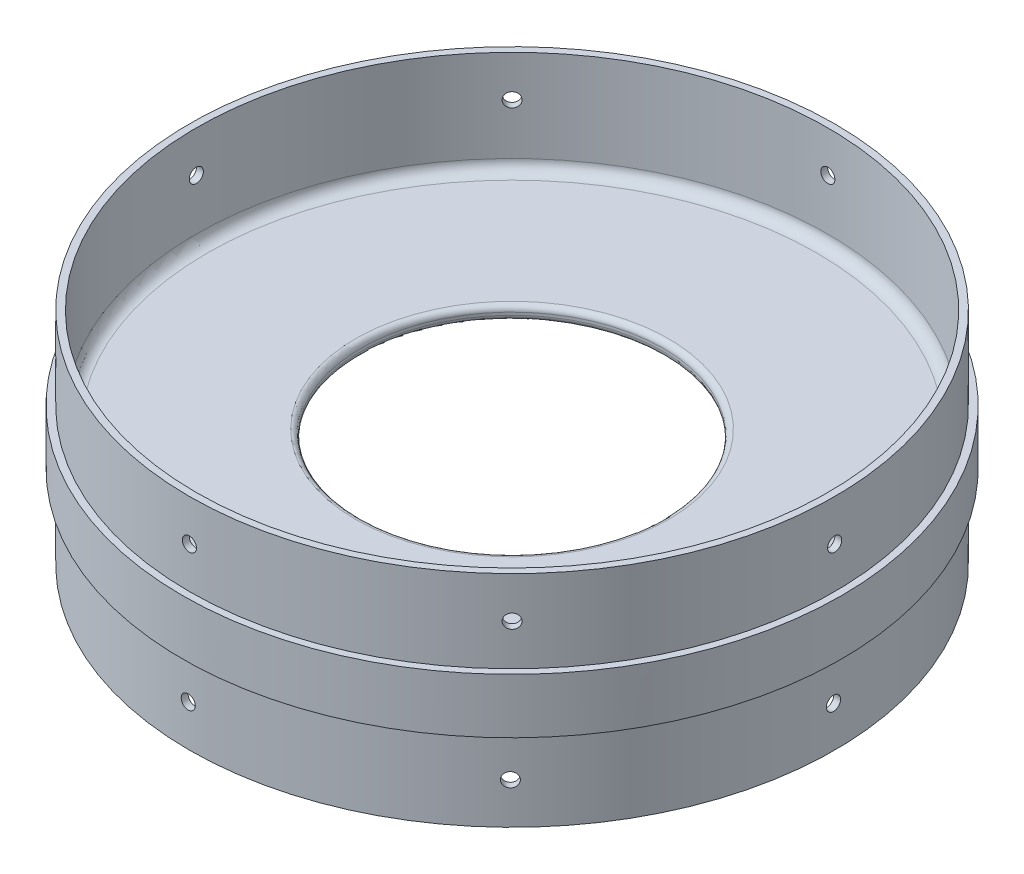
from build123d import *

# Parameters (mm, degrees)
SKETCH3_R                          = 152.4
BOSS_EXTRUDE1_DEPTH                = 101.6
CUT_EXTRUDE1_START                 = -38.1
SKETCH5_R                          = 152.4
SKETCH5_R_2                        = 149.225
CUT_EXTRUDE1_DEPTH                 = 38.1
SKETCH9_R                          = 146.05
CUT_EXTRUDE2_DEPTH                 = 47.625
SKETCH10_R                         = 69.85
CUT_EXTRUDE3_DEPTH                 = 223.181953869
SKETCH13_R                         = 152.4
SKETCH13_R_2                       = 149.225
CUT_EXTRUDE5_DEPTH                 = 38.1
CUT_EXTRUDE6_START                 = -47.625
SKETCH14_R                         = 146.05
CUT_EXTRUDE6_DEPTH                 = 47.625
FILLET3_R                          = 5.08
FILLET4_R                          = 2.54
F_START                            = -149.2250001
F_0_257_DIAMETER_HOLE6_OUTLINE_R   = 3.2639
F_0_257_DIAMETER_HOLE6_DEPTH       = 3.21147529
F_START_2                          = 146.013524844
F_0_257_DIAMETER_HOLE6_2_OUTLINE_R = 3.2639
F_0_257_DIAMETER_HOLE6_2_DEPTH     = 3.211475257
CIRPATTERN1_COUNT                  = 8


# Read off the part's stored shape, not the designer's step: F (0.257) Diameter Hole6
with BuildPart() as part:
    # Sketch3 → Boss-Extrude1 (new body)
    with BuildSketch(Plane(origin=(0, 0, 0), x_dir=(1, 0, 0), z_dir=(0, 1, 0))):
        with Locations(Location((0, 0, 0), (0, 0, 270))):
            Circle(SKETCH3_R)
    extrude(amount=BOSS_EXTRUDE1_DEPTH)

    # Sketch5 → Cut-Extrude1 (cut)
    with BuildSketch(Plane(origin=(0, 101.6, 0), x_dir=(1, 0, 0), z_dir=(0, 1, 0)).offset(CUT_EXTRUDE1_START)):
        with Locations(Location((0, 0, 0), (0, 0, 270))):
            Circle(SKETCH5_R)
        with Locations(Location((0, 0, 0), (0, 0, 270))):
            Circle(SKETCH5_R_2, mode=Mode.SUBTRACT)
    extrude(amount=CUT_EXTRUDE1_DEPTH, mode=Mode.SUBTRACT)

    # Sketch9 → Cut-Extrude2 (cut)
    with BuildSketch(Plane(origin=(0, 101.6, 0), x_dir=(1, 0, 0), z_dir=(0, 1, 0))):
        with Locations(Location((0, 0, 0), (0, 0, 270))):
            Circle(SKETCH9_R)
    extrude(amount=-CUT_EXTRUDE2_DEPTH, mode=Mode.SUBTRACT)

    # Sketch10 → Cut-Extrude3 (cut, through all)
    with BuildSketch(Plane(origin=(0, 53.975, 0), x_dir=(1, 0, 0), z_dir=(0, 1, 0))):
        with Locations(Location((0, 0, 0), (0, 0, 270))):
            Circle(SKETCH10_R)
    extrude(amount=-CUT_EXTRUDE3_DEPTH, mode=Mode.SUBTRACT)

    # Sketch13 → Cut-Extrude5 (cut)
    with BuildSketch(Plane.XZ):
        with Locations(Location((0, 0, 0), (0, 0, 270))):
            Circle(SKETCH13_R)
        with Locations(Location((0, 0, 0), (0, 0, 90))):
            Circle(SKETCH13_R_2, mode=Mode.SUBTRACT)
    extrude(amount=-CUT_EXTRUDE5_DEPTH, mode=Mode.SUBTRACT)

    # Sketch14 → Cut-Extrude6 (cut)
    with BuildSketch(Plane(origin=(0, 0, 0), x_dir=(-1, 0, 0), z_dir=(0, -1, 0)).offset(CUT_EXTRUDE6_START)):
        with Locations(Location((0, 0, 0), (0, 0, 270))):
            Circle(SKETCH14_R)
    extrude(amount=CUT_EXTRUDE6_DEPTH, mode=Mode.SUBTRACT)

    # Fillet3
    fillet3_edges = [part.edges().sort_by_distance(p)[0] for p in [
        (0, 53.975, -146.05),
        (0, 47.625, -146.05),
    ]]
    fillet(fillet3_edges, radius=FILLET3_R)

    # Fillet4
    fillet4_edges = [part.edges().sort_by_distance(p)[0] for p in [
        (0, 53.975, -69.85),
        (0, 47.625, -69.85),
    ]]
    fillet(fillet4_edges, radius=FILLET4_R)

    # F (0.257) Diameter Hole6 outline → F (0.257) Diameter Hole6 (cut)
    with BuildSketch(Plane(origin=(0, 0, 0), x_dir=(0.9999930254411594, 0, 0.0037348452493803923), z_dir=(0.003734845249380392, 0, -0.9999930254411594)).offset(F_START)):
        with Locations((0, -19.052445877)):
            Circle(F_0_257_DIAMETER_HOLE6_OUTLINE_R)
    f_0_257_diameter_hole6 = extrude(amount=F_0_257_DIAMETER_HOLE6_DEPTH, mode=Mode.SUBTRACT)

    # F _0.257_ Diameter Hole6 2 outline → F _0.257_ Diameter Hole6 2 (cut)
    with BuildSketch(Plane.XY.offset(F_START_2)):
        with Locations((0, 82.55)):
            Circle(F_0_257_DIAMETER_HOLE6_2_OUTLINE_R)
    f_0_257_diameter_hole6_2 = extrude(amount=F_0_257_DIAMETER_HOLE6_2_DEPTH, mode=Mode.SUBTRACT)

    # CirPattern1: F (0.257) Diameter Hole6, F _0.257_ Diameter Hole6 2 ×8 about axis
    cirpattern1_axis = Axis((0, 63.5, 0), (0, 1, 0))
    add([f_0_257_diameter_hole6.rotate(cirpattern1_axis, i * 360 / CIRPATTERN1_COUNT) for i in range(1, CIRPATTERN1_COUNT)], mode=Mode.SUBTRACT)
    add([f_0_257_diameter_hole6_2.rotate(cirpattern1_axis, i * 360 / CIRPATTERN1_COUNT) for i in range(1, CIRPATTERN1_COUNT)], mode=Mode.SUBTRACT)


solid = part.part
